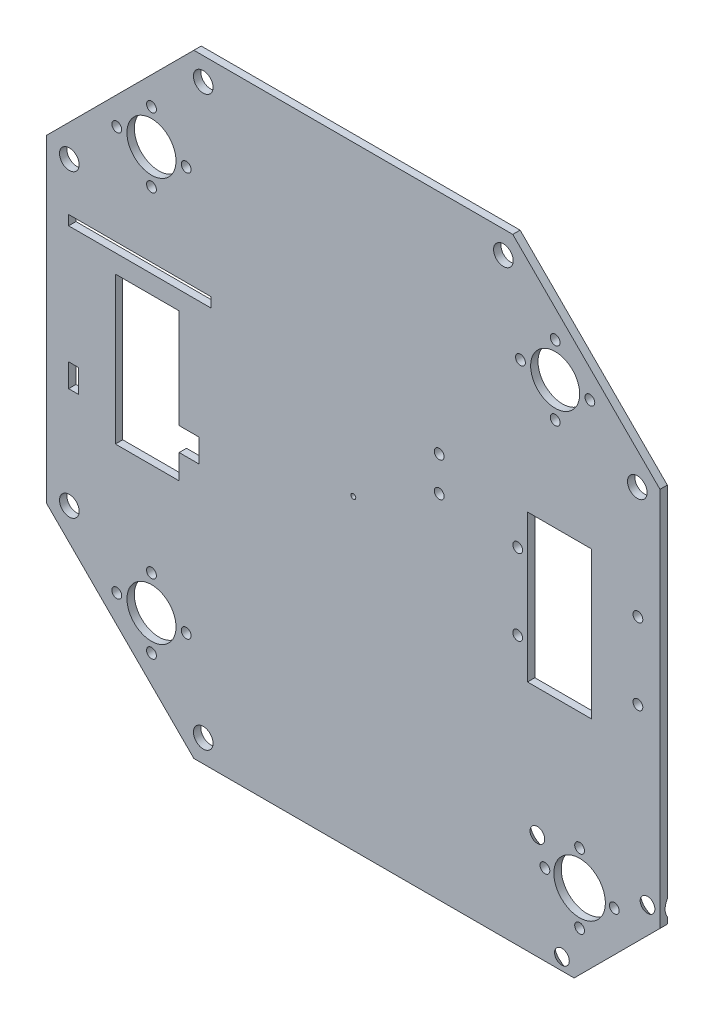
from build123d import *

# Parameters (mm, degrees)
ESQUISSE1_R      = 2
ESQUISSE1_R_2    = 3
ESQUISSE1_R_3    = 10
ESQUISSE1_R_4    = 10.5
ESQUISSE1_R_5    = 2.000000001
ESQUISSE1_R_6    = 4
ESQUISSE1_R_7    = 1
ESQUISSE1_W      = 26
ESQUISSE1_H      = 60
ESQUISSE1_W_2    = 58
ESQUISSE1_H_2    = 4
ESQUISSE1_W_3    = 4
ESQUISSE1_H_3    = 9.5
EXTRUSION1_DEPTH = 3
CHANFREIN2_SIZE  = 3


with BuildPart() as part:
    # Esquisse1 → Extrusion1 (new body)
    with BuildSketch(Plane.XY):
        Polygon((-246.047840708, 39), (-186.047840708, -21), (-31.047840709, -21), (3.952159291, 14), (3.952159291, 169), (-56.047840709, 229), (-186.047840709, 229), (-246.047840708, 169), align=None)
        with Locations((-42.950847728, 11.872642083)):
            Circle(ESQUISSE1_R, mode=Mode.SUBTRACT)
        with Locations(Location((-1.12231419, 19.771416552, 0), (0, 0, 180))):
            Circle(ESQUISSE1_R_2, mode=Mode.SUBTRACT)
        with Locations((-36.022827062, -16)):
            Circle(ESQUISSE1_R_2, mode=Mode.SUBTRACT)
        with Locations((-28.808712104, 26.014777707)):
            Circle(ESQUISSE1_R, mode=Mode.SUBTRACT)
        with Locations((-203.319918647, 21.727922061)):
            Circle(ESQUISSE1_R_3, mode=Mode.SUBTRACT)
        with Locations(Location((-203.319918647, 7.585786438, 0), (0, 0, 180))):
            Circle(ESQUISSE1_R, mode=Mode.SUBTRACT)
        with Locations((-189.177783023, 21.727922061)):
            Circle(ESQUISSE1_R, mode=Mode.SUBTRACT)
        with Locations(Location((-203.319918647, 35.870057685, 0), (0, 0, 180))):
            Circle(ESQUISSE1_R, mode=Mode.SUBTRACT)
        with Locations((-28.808781353, 11.872704562)):
            Circle(ESQUISSE1_R_4, mode=Mode.SUBTRACT)
        with Locations((-217.462054271, 21.727922061)):
            Circle(ESQUISSE1_R, mode=Mode.SUBTRACT)
        with Locations(Location((-38.77576277, 172.129942315, 0), (0, 0, 180))):
            Circle(ESQUISSE1_R, mode=Mode.SUBTRACT)
        with Locations((-52.917898394, 186.272077939)):
            Circle(ESQUISSE1_R_5, mode=Mode.SUBTRACT)
        with Locations(Location((-38.77576277, 200.414213562, 0), (0, 0, 180))):
            Circle(ESQUISSE1_R, mode=Mode.SUBTRACT)
        with Locations((-24.633627146, 186.272077939)):
            Circle(ESQUISSE1_R, mode=Mode.SUBTRACT)
        with Locations((-38.77576277, 186.272077939)):
            Circle(ESQUISSE1_R_3, mode=Mode.SUBTRACT)
        with Locations(Location((-203.319918647, 186.272077939, 0), (0, 0, 180))):
            Circle(ESQUISSE1_R_3, mode=Mode.SUBTRACT)
        with Locations(Location((-217.462054271, 186.272077939, 0), (0, 0, 180))):
            Circle(ESQUISSE1_R, mode=Mode.SUBTRACT)
        with Locations((-203.319918647, 200.414213562)):
            Circle(ESQUISSE1_R, mode=Mode.SUBTRACT)
        with Locations(Location((-189.177783023, 186.272077939, 0), (0, 0, 180))):
            Circle(ESQUISSE1_R, mode=Mode.SUBTRACT)
        with Locations((-203.319918647, 172.129942315)):
            Circle(ESQUISSE1_R, mode=Mode.SUBTRACT)
        with Locations(Location((-182.221006385, -11.761204675, 0), (0, 0, 180))):
            Circle(ESQUISSE1_R_6, mode=Mode.SUBTRACT)
        with Locations((-182.221006385, 219.761204675)):
            Circle(ESQUISSE1_R_6, mode=Mode.SUBTRACT)
        with Locations((-236.809045383, 42.826834324)):
            Circle(ESQUISSE1_R_6, mode=Mode.SUBTRACT)
        with Locations((-5.047840709, 119.5)):
            Circle(ESQUISSE1_R, mode=Mode.SUBTRACT)
        with Locations(Location((-236.809045383, 165.173165676, 0), (0, 0, 180))):
            Circle(ESQUISSE1_R_6, mode=Mode.SUBTRACT)
        with Locations((-28.808712104, -2.269493541)):
            Circle(ESQUISSE1_R, mode=Mode.SUBTRACT)
        with Locations((-14.66657648, 11.872642083)):
            Circle(ESQUISSE1_R, mode=Mode.SUBTRACT)
        with Locations((-5.286636034, 165.173165676)):
            Circle(ESQUISSE1_R_6, mode=Mode.SUBTRACT)
        with Locations(Location((-59.874675032, 219.761204675, 0), (0, 0, 180))):
            Circle(ESQUISSE1_R_6, mode=Mode.SUBTRACT)
        with Locations(Location((-5.047840709, 88.5, 0), (0, 0, 180))):
            Circle(ESQUISSE1_R, mode=Mode.SUBTRACT)
        with Locations((-86.047840709, 136.5)):
            Circle(ESQUISSE1_R, mode=Mode.SUBTRACT)
        with Locations((-86.047840709, 122.5)):
            Circle(ESQUISSE1_R, mode=Mode.SUBTRACT)
        with Locations((-54.047840709, 119.5)):
            Circle(ESQUISSE1_R, mode=Mode.SUBTRACT)
        with Locations(Location((-54.047840709, 88.5, 0), (0, 0, 180))):
            Circle(ESQUISSE1_R, mode=Mode.SUBTRACT)
        with Locations((-46.022827062, 22)):
            Circle(ESQUISSE1_R_2, mode=Mode.SUBTRACT)
        with Locations((-121.047840709, 104)):
            Circle(ESQUISSE1_R_7, mode=Mode.SUBTRACT)
        Polygon((-192.047840709, 74), (-192.047840709, 84), (-184.047840709, 84), (-184.047840709, 93.5), (-192.047840709, 93.5), (-192.047840709, 134), (-218.047840709, 134), (-218.047840709, 104), (-218.047840709, 74), align=None, mode=Mode.SUBTRACT)
        with Locations((-37.047840709, 104)):
            Rectangle(ESQUISSE1_W, ESQUISSE1_H, mode=Mode.SUBTRACT)
        with Locations((-208.095681417, 143.5)):
            Rectangle(ESQUISSE1_W_2, ESQUISSE1_H_2, mode=Mode.SUBTRACT)
        with Locations((-235.095681417, 88.75)):
            Rectangle(ESQUISSE1_W_3, ESQUISSE1_H_3, mode=Mode.SUBTRACT)
    extrude(amount=EXTRUSION1_DEPTH)

    # Chanfrein2
    # the kernel refuses this chamfer: 3 mm, written as the material it takes off along each edge
    with BuildSketch(Plane(origin=(-46.022827062, 22, 0), x_dir=(1, 0, 0), z_dir=(0, -1, 0))) as chanfrein2_piece_1:
        Polygon((3, CHANFREIN2_SIZE), (3 + CHANFREIN2_SIZE, 0), (3, 0), align=None)
    revolve(axis=Axis((-46.022827062, 22, 0), (0, 0, 1)), mode=Mode.SUBTRACT)
    with BuildSketch(Plane(origin=(-36.022827062, -16, 0), x_dir=(1, 0, 0), z_dir=(0, -1, 0))) as chanfrein2_piece_2:
        Polygon((3, CHANFREIN2_SIZE), (3 + CHANFREIN2_SIZE, 0), (3, 0), align=None)
    revolve(axis=Axis((-36.022827062, -16, 0), (0, 0, 1)), mode=Mode.SUBTRACT)
    with BuildSketch(Plane(origin=(-1.12231419, 19.771416552, 0), x_dir=(-1, 0, 0), z_dir=(0, 1, 0))) as chanfrein2_piece_3:
        Polygon((3, CHANFREIN2_SIZE), (3 + CHANFREIN2_SIZE, 0), (3, 0), align=None)
    revolve(axis=Axis((-1.12231419, 19.771416552, 0), (0, 0, 1)), mode=Mode.SUBTRACT)


solid = part.part
